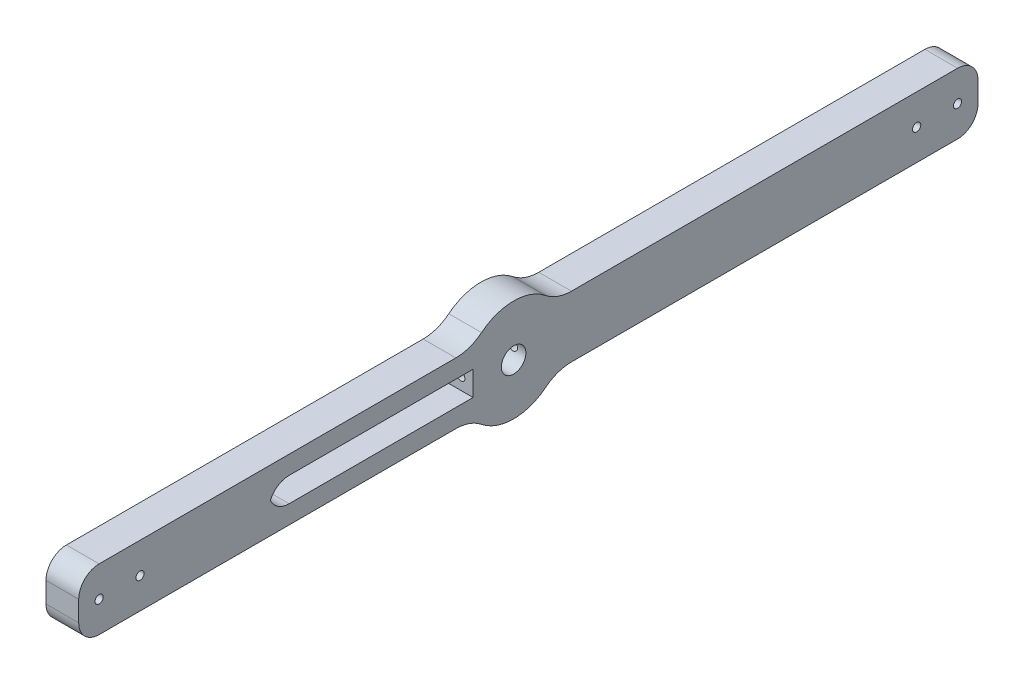
from build123d import *

# Parameters (mm, degrees)
SKETCH_1_W               = 120
SKETCH_1_H               = 15
EXTRUDE_1_DEPTH          = 8
FILLET_1_R               = 5
SKETCH_6_R               = 12.5
EXTRUDE_2_DEPTH          = 8
SKETCH_8_R               = 3
CUT_EXTRUDE_5_DEPTH      = 23
SKETCH_9_W               = 8
SKETCH_9_H               = 15
EXTRUDE_3_DEPTH          = 100
SKETCH_10_W              = 50
SKETCH_10_H              = 6
CUT_EXTRUDE_6_DEPTH      = 10
CUT_EXTRUDE_7_DEPTH      = 7
CUT_EXTRUDE_7_DEPTH_BACK = 15
SKETCH_4_R               = 1
FILLET_2_R               = 10
FILLET_4_R               = 5
FILLET_5_R               = 5
SKETCH_11_R              = 1
CUT_EXTRUDE_8_DEPTH      = 10


with BuildPart() as part:
    # 草图1 → 凸台-拉伸1 (new body)
    with BuildSketch(Plane(origin=(0, 0, 0), x_dir=(0, 0, -1), z_dir=(1, 0, 0))):
        with Locations((60, 7.5)):
            Rectangle(SKETCH_1_W, SKETCH_1_H)
    extrude(amount=EXTRUDE_1_DEPTH)

    # 圆角1
    fillet_1_edges = [part.edges().sort_by_distance(p)[0] for p in [
        (4, 15, 0),
        (4, 15, -120),
        (4, 0, -120),
        (4, 0, 0),
    ]]
    fillet(fillet_1_edges, radius=FILLET_1_R)

    # 草图6 → 凸台-拉伸2 (add)
    with BuildSketch(Plane(origin=(8, 0, 0), x_dir=(0, 0, -1), z_dir=(1, 0, 0))):
        with Locations((6.4, 7.5)):
            Circle(SKETCH_6_R)
    extrude(amount=-EXTRUDE_2_DEPTH)

    # 草图8 → 切除-拉伸5 (cut)
    with BuildSketch(Plane.ZY):
        with Locations((-6.4, 7.5)):
            Circle(SKETCH_8_R)
    extrude(amount=-CUT_EXTRUDE_5_DEPTH, mode=Mode.SUBTRACT)

    # 草图9 → 凸台-拉伸3 (add)
    with BuildSketch(Plane.XY):
        with Locations((4, 7.5)):
            Rectangle(SKETCH_9_W, SKETCH_9_H)
    extrude(amount=EXTRUDE_3_DEPTH)

    # 草图10 → 切除-拉伸6 (cut)
    with BuildSketch(Plane.ZY):
        with Locations((28.522995474, 7.5)):
            Rectangle(SKETCH_10_W, SKETCH_10_H)
    extrude(amount=-CUT_EXTRUDE_6_DEPTH, mode=Mode.SUBTRACT)

    # 草图4 → 切除-拉伸7 (cut, two sides: drawn at the far end of the back side and taken through both)
    with BuildSketch(Plane.XY.offset(-CUT_EXTRUDE_7_DEPTH_BACK)):
        with Locations(Location((5, 7.5, 0), (0, 0, 180))):
            Circle(SKETCH_4_R)
    extrude(amount=CUT_EXTRUDE_7_DEPTH + CUT_EXTRUDE_7_DEPTH_BACK, mode=Mode.SUBTRACT)

    # 圆角2
    fillet_2_edges = [part.edges().sort_by_distance(p)[0] for p in [
        (4, 0, -16.4),
        (4, 15, -16.4),
        (4, 15, 3.6),
        (4, 0, 3.6),
    ]]
    fillet(fillet_2_edges, radius=FILLET_2_R)

    # 圆角4
    fillet_4_edges = [part.edges().sort_by_distance(p)[0] for p in [
        (4, 0, 100),
        (4, 15, 100),
    ]]
    fillet(fillet_4_edges, radius=FILLET_4_R)

    # 圆角5
    # the kernel refuses this fillet: 5 mm, written as the material it adds along each edge
    with BuildSketch(Plane(origin=(0, 10.5, 53.522995474), x_dir=(0, 0, -1), z_dir=(1, 0, 0)), Plane(origin=(0, 4.5, 53.522995474), x_dir=(0, 1, 0), z_dir=(1, 0, 0))) as fillet_5_piece_1:
        with BuildLine():
            CenterArc((FILLET_5_R, -FILLET_5_R), FILLET_5_R, 90, 90)
            Line((0, -FILLET_5_R), (0, 0))
            Line((0, 0), (FILLET_5_R, 0))
        make_face()
    extrude(amount=8)

    # 草图11 → 切除-拉伸8 (cut)
    with BuildSketch(Plane.ZY):
        with Locations((-115, 7.5)):
            Circle(SKETCH_11_R)
        with Locations((-105, 7.5)):
            Circle(SKETCH_11_R)
        with Locations((85, 7.5)):
            Circle(SKETCH_11_R)
        with Locations((95, 7.5)):
            Circle(SKETCH_11_R)
    extrude(amount=-CUT_EXTRUDE_8_DEPTH, mode=Mode.SUBTRACT)


solid = part.part
